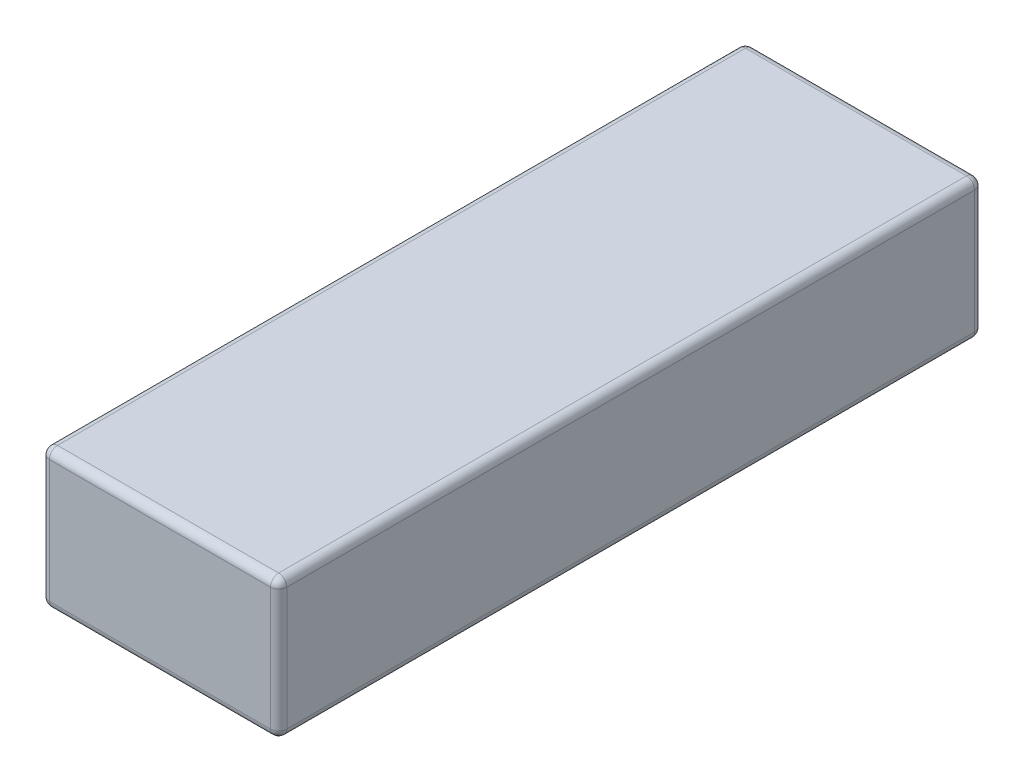
from build123d import *

# Parameters (mm, degrees)
SKETCH1_W           = 29
SKETCH1_H           = 17
BOSS_EXTRUDE1_DEPTH = 86
FILLET1_R           = 1


with BuildPart() as part:
    # Sketch1 → Boss-Extrude1 (new body)
    with BuildSketch(Plane.XY):
        Rectangle(SKETCH1_W, SKETCH1_H)
    extrude(amount=BOSS_EXTRUDE1_DEPTH)

    # Fillet1
    fillet1_edges = [part.edges().sort_by_distance(p)[0] for p in [
        (-14.5, -8.5, 43),
        (14.5, -8.5, 43),
        (14.5, 8.5, 43),
        (0, -8.5, 86),
        (-14.5, 0, 86),
        (0, 8.5, 86),
        (14.5, 0, 86),
        (0, 8.5, 0),
        (-14.5, 0, 0),
        (0, -8.5, 0),
        (14.5, 0, 0),
        (-14.5, 8.5, 43),
    ]]
    fillet(fillet1_edges, radius=FILLET1_R)


solid = part.part
